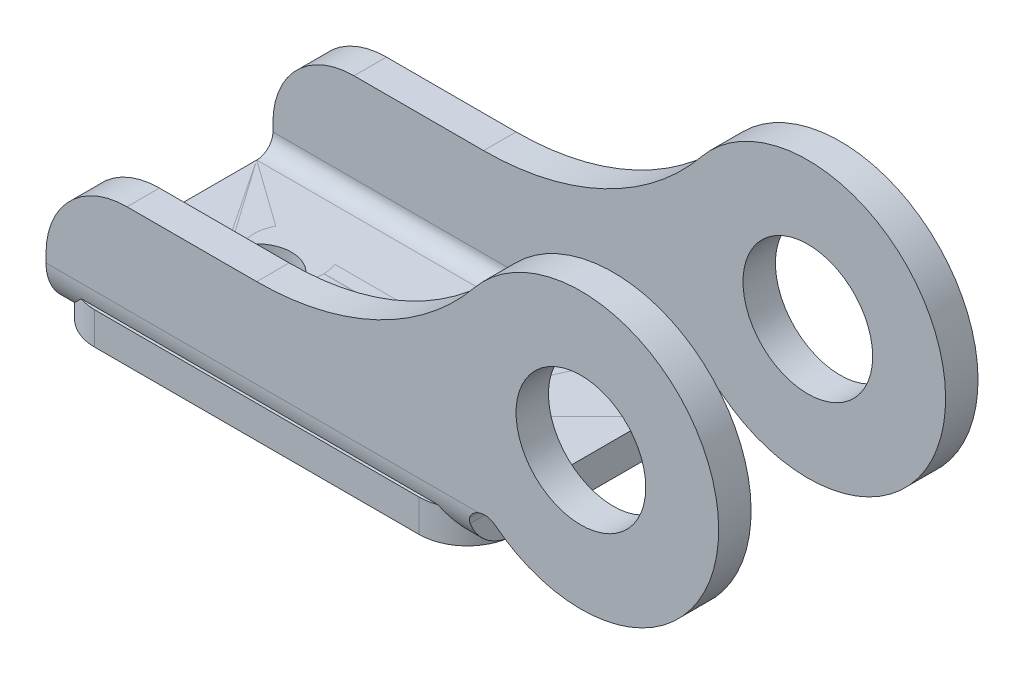
from build123d import *

# Parameters (mm, degrees)
SKETCH_1_W          = 26
SKETCH_1_H          = 16
EXTRUDE_1_DEPTH     = 2
EXTRUDE_2_DEPTH     = 2
FILLET_1_R          = 5
FILLET_2_R          = 3
SKETCH_4_R          = 4
CUT_EXTRUDE_1_DEPTH = 38.312866414
SKETCH_5_R          = 2.15
CUT_EXTRUDE_2_DEPTH = 34.648922717
FILLET_3_R          = 3
FILLET_START        = -13
FILLET_4_DEPTH      = 26.69955789
FILLET_START_2      = 4
FILLET_4_2_DEPTH    = 2


with BuildPart() as part:
    # 草图1 → 凸台-拉伸1 (new body)
    with BuildSketch(Plane(origin=(0, 0, 0), x_dir=(1, 0, 0), z_dir=(0, 1, 0))):
        Rectangle(SKETCH_1_W, SKETCH_1_H)
    extrude(amount=EXTRUDE_1_DEPTH)

    # 草图3 → 凸台-拉伸2 (add)
    with BuildSketch(Plane.XY.offset(8)):
        with BuildLine():
            Line((-13, 2), (-13, 8.5))
            Line((-13, 8.5), (0, 8.5))
            ThreePointArc((0, 8.5), (7.423811989, 10.173553708), (13.411524732, 14.870474248))
            ThreePointArc((13.411524732, 14.870474248), (28.449822139, 10.422228722), (14.725126476, 2.834738617))
            ThreePointArc((14.725126476, 2.834738617), (13.600854496, 2.958234042), (13, 2))
            Line((13, 2), (-13, 2))
        make_face()
    extrude(amount=-EXTRUDE_2_DEPTH)

    # 圆角1
    fillet_1_edges = [part.edges().sort_by_distance(p)[0] for p in [
        (-13, 8.5, 7),
    ]]
    fillet(fillet_1_edges, radius=FILLET_1_R)

    # 圆角2
    fillet_2_edges = [part.edges().sort_by_distance(p)[0] for p in [
        (-13, 1, -8),
        (13, 1, -8),
    ]]
    fillet(fillet_2_edges, radius=FILLET_2_R)

    # 草图4 → 切除-拉伸1 (cut, through all)
    with BuildSketch(Plane.XY.offset(8)):
        with Locations((20, 9.5)):
            Circle(SKETCH_4_R)
    extrude(amount=-CUT_EXTRUDE_1_DEPTH, mode=Mode.SUBTRACT)

    # 草图5 → 切除-拉伸2 (cut, through all)
    with BuildSketch(Plane(origin=(0, 2, 0), x_dir=(1, 0, 0), z_dir=(0, 1, 0))):
        with Locations(Location((-7, 1, 0), (0, 0, 270))):
            Circle(SKETCH_5_R)
        with Locations(Location((6, 1, 0), (0, 0, 270))):
            Circle(SKETCH_5_R)
    extrude(amount=-CUT_EXTRUDE_2_DEPTH, mode=Mode.SUBTRACT)

    # 圆角3
    fillet_3_edges = [part.edges().sort_by_distance(p)[0] for p in [
        (0, 0, 8),
    ]]
    fillet(fillet_3_edges, radius=FILLET_3_R)

    # 圆角4: read off the stored shape, not the designer's step
    # 圆角4 outline → 圆角4 (add)
    with BuildSketch(Plane.YZ.offset(FILLET_START)):
        with BuildLine():
            ThreePointArc((2, 5), (2.292893219, 5.707106781), (3, 6))
            Line((3, 6), (2, 6))
            Line((2, 6), (2, 5))
        make_face()
    extrude(amount=FILLET_4_DEPTH)

    # Fillet 4 2 outline → Fillet 4 2 (cut)
    with BuildSketch(Plane.XY.offset(FILLET_START_2)):
        with BuildLine():
            Line((13.69955789, 2), (13.699557878, 3.000000032))
            ThreePointArc((13.699557878, 3.000000032), (13.19224914, 2.610200695), (13, 1.999999133))
            Line((13, 1.999999133), (13.69955789, 2))
        make_face()
    extrude(amount=FILLET_4_2_DEPTH, mode=Mode.SUBTRACT)


with BuildPart() as body_2:
    # 镜向1: mirrored copy
    add(part.part.mirror(Plane.XY))


solid = Compound([part.part, body_2.part])
